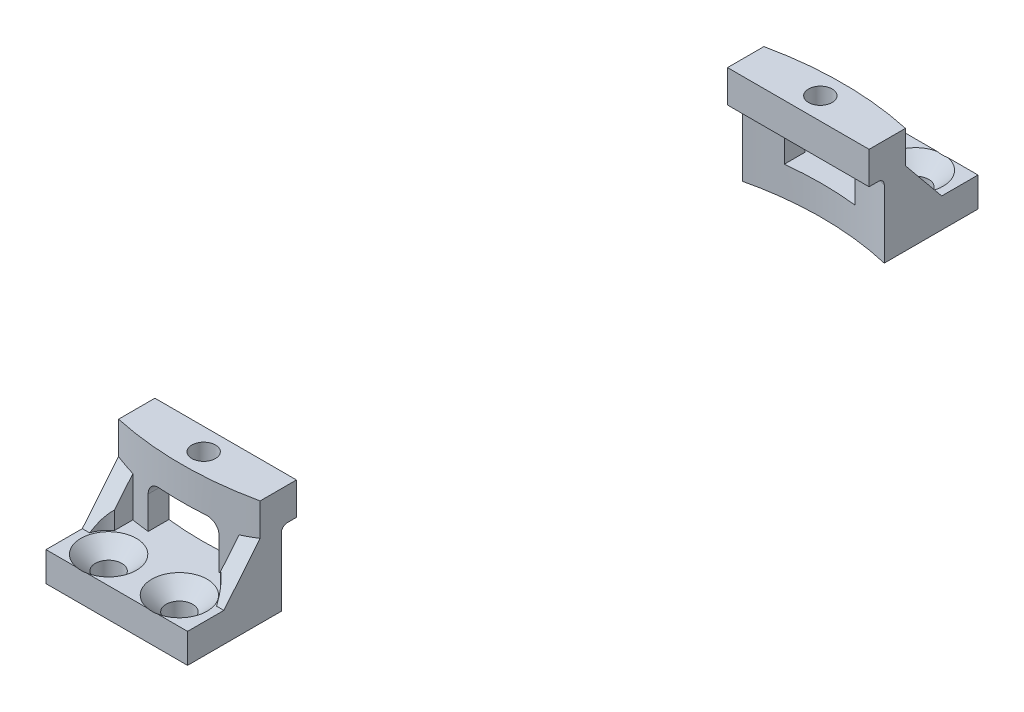
from build123d import *

# Parameters (mm, degrees)
BOSS_EXTRUDE2_DEPTH                            = 5
BOSS_EXTRUDE2_2_DEPTH                          = 5
CSK_FOR_M4_FLAT_HEAD_MACHINE_SCREW3_AT_2_COUNT = 2
CSK_FOR_M4_FLAT_HEAD_MACHINE_SCREW3_AT_2_PITCH = 12
CSK_FOR_M4_FLAT_HEAD_MACHINE_SCREW5_AT_2_COUNT = 2
CSK_FOR_M4_FLAT_HEAD_MACHINE_SCREW5_AT_2_PITCH = 12
BOSS_EXTRUDE3_DEPTH                            = 13
BOSS_EXTRUDE3_DEPTH_BACK                       = 5
BOSS_EXTRUDE3_2_DEPTH                          = 13
BOSS_EXTRUDE3_2_DEPTH_BACK                     = 5
BOSS_EXTRUDE4_DEPTH                            = 3
BOSS_EXTRUDE5_DEPTH                            = 3
CUT_EXTRUDE5_DEPTH                             = 12.5
CUT_EXTRUDE5_DEPTH_BACK                        = 71.405965656
SKETCH28_R                                     = 52.5
FILLET5_R                                      = 1
FILLET6_R                                      = 1
SKETCH30_R                                     = 5
CUT_EXTRUDE10_DEPTH                            = 13
MIRROR4_START                                  = 5
MIRROR4_DEPTH                                  = 3.005808181
CUT_EXTRUDE11_DEPTH                            = 118.546494541
CUT_EXTRUDE11_DEPTH_BACK                       = 13
CUT_EXTRUDE12_DEPTH                            = 13
SKETCH32_R                                     = 5
CUT_EXTRUDE13_DEPTH                            = 12
FILLET7_R                                      = 2
FILLET8_R                                      = 2


# Read off the part's stored shape, not the designer's step: Mirror4
with BuildPart() as part:
    # Sketch2 → Boss-Extrude2 (new body)
    with BuildSketch(Plane(origin=(0, 0, 0), x_dir=(1, 0, 0), z_dir=(0, 1, 0))):
        with BuildLine():
            Line((-12, -67), (12, -67))
            Line((12, -67), (12, -54.699177325))
            ThreePointArc((12, -54.699177325), (0, -56), (-12, -54.699177325))
            Line((-12, -54.699177325), (-12, -67))
        make_face()
    extrude(amount=BOSS_EXTRUDE2_DEPTH)

    # Sketch9 → CSK for M4 Flat Head Machine Screw5 (revolve, cut)
    with BuildSketch(Plane(origin=(-6, 5, 62.3846611), x_dir=(0, 0, 1), z_dir=(1, 0, 0))):
        Polygon((0, 0), (0, 5), (2.25, 5), (2.25, 2.45), (4.7, 0), align=None)
    csk_for_m4_flat_head_machine_screw5 = revolve(axis=Axis((-6, 11.35, 62.3846611), (0, -1, 0)), mode=Mode.SUBTRACT)

    # CSK for M4 Flat Head Machine Screw5 at 2: CSK for M4 Flat Head Machine Screw5 ×2
    with Locations(*[(i * CSK_FOR_M4_FLAT_HEAD_MACHINE_SCREW5_AT_2_PITCH, 0, 0) for i in range(1, CSK_FOR_M4_FLAT_HEAD_MACHINE_SCREW5_AT_2_COUNT)]):
        add(csk_for_m4_flat_head_machine_screw5, mode=Mode.SUBTRACT)



with BuildPart() as body_2:
    # Sketch2 → Boss-Extrude2 2 (new body)
    with BuildSketch(Plane(origin=(0, 0, 0), x_dir=(1, 0, 0), z_dir=(0, 1, 0))):
        with BuildLine():
            Line((-12, 67), (-12, 54.699177325))
            ThreePointArc((-12, 54.699177325), (0, 56), (12, 54.699177325))
            Line((12, 54.699177325), (12, 67))
            Line((12, 67), (-12, 67))
        make_face()
    extrude(amount=BOSS_EXTRUDE2_2_DEPTH)

    # Sketch6 → CSK for M4 Flat Head Machine Screw3 (revolve, cut)
    with BuildSketch(Plane(origin=(6, 5, -62.3846611), x_dir=(0, 0, 1), z_dir=(1, 0, 0))):
        Polygon((0, 0), (0, 5), (2.25, 5), (2.25, 2.45), (4.7, 0), align=None)
    csk_for_m4_flat_head_machine_screw3 = revolve(axis=Axis((6, 11.35, -62.3846611), (0, -1, 0)), mode=Mode.SUBTRACT)

    # CSK for M4 Flat Head Machine Screw3 at 2: CSK for M4 Flat Head Machine Screw3 ×2
    with Locations(*[(-i * CSK_FOR_M4_FLAT_HEAD_MACHINE_SCREW3_AT_2_PITCH, 0, 0) for i in range(1, CSK_FOR_M4_FLAT_HEAD_MACHINE_SCREW3_AT_2_COUNT)]):
        add(csk_for_m4_flat_head_machine_screw3, mode=Mode.SUBTRACT)



with BuildPart() as body_3:
    # Sketch10 → Boss-Extrude3 (new, two sides: drawn at the far end of the back side and taken through both)
    with BuildSketch(Plane(origin=(0, 5, 0), x_dir=(1, 0, 0), z_dir=(0, 1, 0)).offset(-BOSS_EXTRUDE3_DEPTH_BACK)):
        with BuildLine():
            Line((-12, -48.5386444), (-12, -54.699177325))
            ThreePointArc((-12, -54.699177325), (0, -56), (12, -54.699177325))
            Line((12, -54.699177325), (12, -48.5386444))
            Line((12, -48.5386444), (-12, -48.5386444))
        make_face()
    extrude(amount=BOSS_EXTRUDE3_DEPTH + BOSS_EXTRUDE3_DEPTH_BACK)


with BuildPart() as body_4:
    # Sketch10 → Boss-Extrude3 2 (new, two sides: drawn at the far end of the back side and taken through both)
    with BuildSketch(Plane(origin=(0, 5, 0), x_dir=(1, 0, 0), z_dir=(0, 1, 0)).offset(-BOSS_EXTRUDE3_2_DEPTH_BACK)):
        with BuildLine():
            ThreePointArc((12, 54.699177325), (0, 56), (-12, 54.699177325))
            Line((-12, 54.699177325), (-12, 48.5386444))
            Line((-12, 48.5386444), (12, 48.5386444))
            Line((12, 48.5386444), (12, 54.699177325))
        make_face()
    extrude(amount=BOSS_EXTRUDE3_2_DEPTH + BOSS_EXTRUDE3_2_DEPTH_BACK)


with BuildPart() as part_1:
    add(part.part)

    add(body_3.part)  # Boss-Extrude4 merges body 3
    # Sketch21 → Boss-Extrude4 (add)
    with BuildSketch(Plane(origin=(12, 0, 0), x_dir=(0, 0, -1), z_dir=(1, 0, 0))):
        Polygon((-54.699177325, 5), (-54.699177325, 12.5), (-60.849588662, 5), align=None)
    boss_extrude4 = extrude(amount=-BOSS_EXTRUDE4_DEPTH)

    # Mirror1: Boss-Extrude4 across plane
    add(boss_extrude4.mirror(Plane(origin=(0, 0, 0), x_dir=(0, 0, 1), z_dir=(1, 0, 0))))


with BuildPart() as body_2_1:
    add(body_2.part)

    add(body_4.part)  # Boss-Extrude5 merges body 4
    # Sketch22 → Boss-Extrude5 (add)
    with BuildSketch(Plane(origin=(12, 0, 0), x_dir=(0, 0, -1), z_dir=(1, 0, 0))):
        Polygon((54.699177325, 12.5), (60.849588662, 5), (54.699177325, 5), align=None)
    boss_extrude5 = extrude(amount=-BOSS_EXTRUDE5_DEPTH)

    # Mirror2: Boss-Extrude5 across plane
    add(boss_extrude5.mirror(Plane(origin=(0, 0, 0), x_dir=(0, 0, 1), z_dir=(1, 0, 0))))


with BuildPart() as cut_extrude5_tool:
    # Sketch28 → Cut-Extrude5 (new, two sides: drawn at the far end of the back side and taken through both)
    with BuildSketch(Plane(origin=(0, 0, 0), x_dir=(1, 0, 0), z_dir=(0, 1, 0)).offset(-CUT_EXTRUDE5_DEPTH_BACK)):
        Circle(SKETCH28_R)
    extrude(amount=CUT_EXTRUDE5_DEPTH + CUT_EXTRUDE5_DEPTH_BACK)


with BuildPart() as part_2:
    add(part_1.part)

    # Cut-Extrude5: cut by cut_extrude5_tool
    add(cut_extrude5_tool.part, mode=Mode.SUBTRACT)

    # Fillet6
    fillet6_edges = [part_2.edges().sort_by_distance(p)[0] for p in [
        (0, 12.5, 52.5),
    ]]
    fillet(fillet6_edges, radius=FILLET6_R)

    # Sketch30 → Cut-Extrude10 (cut)
    with BuildSketch(Plane(origin=(0, 5, 0), x_dir=(1, 0, 0), z_dir=(0, 1, 0))):
        with Locations((-6, -62.3846611)):
            Circle(SKETCH30_R)
    extrude(amount=CUT_EXTRUDE10_DEPTH, mode=Mode.SUBTRACT)

    # Mirror4 outline → Mirror4 (cut)
    with BuildSketch(Plane(origin=(0, 0, 0), x_dir=(1, 0, 0), z_dir=(0, 1, 0)).offset(MIRROR4_START)):
        with BuildLine():
            ThreePointArc((10.758524205, -60.849588662), (10.070336771, -59.480808733), (9, -58.3846611))
            Line((9, -58.3846611), (9, -62))
            Line((9, -62), (11.129640262, -62))
            Line((11.129640262, -62), (10.758524205, -60.849588662))
        make_face()
    extrude(amount=MIRROR4_DEPTH, mode=Mode.SUBTRACT)


with BuildPart() as body_2_2:
    add(body_2_1.part)

    # Cut-Extrude5: cut by cut_extrude5_tool
    add(cut_extrude5_tool.part, mode=Mode.SUBTRACT)

    # Fillet5
    fillet5_edges = [body_2_2.edges().sort_by_distance(p)[0] for p in [
        (0, 12.5, -52.5),
    ]]
    fillet(fillet5_edges, radius=FILLET5_R)


with BuildPart() as cut_extrude11_tool:
    # Sketch31 → Cut-Extrude11 (new, two sides: drawn at the far end of the back side and taken through both)
    with BuildSketch(Plane(origin=(0, 0, 48.5386444), x_dir=(-1, 0, 0), z_dir=(0, 0, -1)).offset(-CUT_EXTRUDE11_DEPTH_BACK)):
        Polygon((0, 5), (0, 8.75), (0, 12.5), (-6, 12.5), (-6, 5), align=None)
        Polygon((0, 12.5), (0, 8.75), (0, 5), (6, 5), (6, 12.5), align=None)
    extrude(amount=CUT_EXTRUDE11_DEPTH + CUT_EXTRUDE11_DEPTH_BACK)


with BuildPart() as part_3:
    add(part_2.part)

    # Cut-Extrude11: cut by cut_extrude11_tool
    add(cut_extrude11_tool.part, mode=Mode.SUBTRACT)


with BuildPart() as body_2_3:
    add(body_2_2.part)

    # Cut-Extrude11: cut by cut_extrude11_tool
    add(cut_extrude11_tool.part, mode=Mode.SUBTRACT)


with BuildPart() as cut_extrude12_tool:
    # Sketch14 → Cut-Extrude12 (new body)
    with BuildSketch(Plane(origin=(0, 18, 0), x_dir=(1, 0, 0), z_dir=(0, 1, 0))):
        with BuildLine():
            ThreePointArc((2, 52.2693222), (1.414213562, 53.683535762), (0, 54.2693222))
            Line((0, 54.2693222), (0, 50.2693222))
            ThreePointArc((0, 50.2693222), (1.414213562, 50.855108638), (2, 52.2693222))
        make_face()
        with BuildLine():
            Line((0, 50.2693222), (0, 54.2693222))
            ThreePointArc((0, 54.2693222), (-2, 52.2693222), (0, 50.2693222))
        make_face()
        with BuildLine():
            ThreePointArc((0, -50.2693222), (-2, -52.2693222), (0, -54.2693222))
            Line((0, -54.2693222), (0, -50.2693222))
        make_face()
        with BuildLine():
            Line((0, -50.2693222), (0, -54.2693222))
            ThreePointArc((0, -54.2693222), (1.414213562, -53.683535762), (2, -52.2693222))
            ThreePointArc((2, -52.2693222), (1.414213562, -50.855108638), (0, -50.2693222))
        make_face()
    extrude(amount=-CUT_EXTRUDE12_DEPTH)


with BuildPart() as part_4:
    add(part_3.part)

    # Cut-Extrude12: cut by cut_extrude12_tool
    add(cut_extrude12_tool.part, mode=Mode.SUBTRACT)

    # Fillet7
    fillet7_edges = [part_4.edges().sort_by_distance(p)[0] for p in [
        (6, 12.5, 53.413467462),
        (-6, 12.5, 53.413467462),
    ]]
    fillet(fillet7_edges, radius=FILLET7_R - 0.0004)  # a hair under: the kernel refuses the full size


with BuildPart() as body_2_4:
    add(body_2_3.part)

    # Cut-Extrude12: cut by cut_extrude12_tool
    add(cut_extrude12_tool.part, mode=Mode.SUBTRACT)

    # Sketch32 → Cut-Extrude13 (cut)
    with BuildSketch(Plane(origin=(0, 5, 0), x_dir=(1, 0, 0), z_dir=(0, 1, 0))):
        with Locations((-6, 62.3846611)):
            Circle(SKETCH32_R)
    cut_extrude13 = extrude(amount=CUT_EXTRUDE13_DEPTH, mode=Mode.SUBTRACT)

    # Mirror5: Cut-Extrude13 across plane
    add(cut_extrude13.mirror(Plane(origin=(0, 0, 0), x_dir=(0, 0, 1), z_dir=(1, 0, 0))), mode=Mode.SUBTRACT)

    # Fillet8
    fillet8_edges = [body_2_4.edges().sort_by_distance(p)[0] for p in [
        (6, 12.5, -53.413467462),
        (-6, 12.5, -53.413467462),
    ]]
    fillet(fillet8_edges, radius=FILLET8_R - 0.0004)  # a hair under: the kernel refuses the full size


solid = Compound([part_4.part, body_2_4.part])
